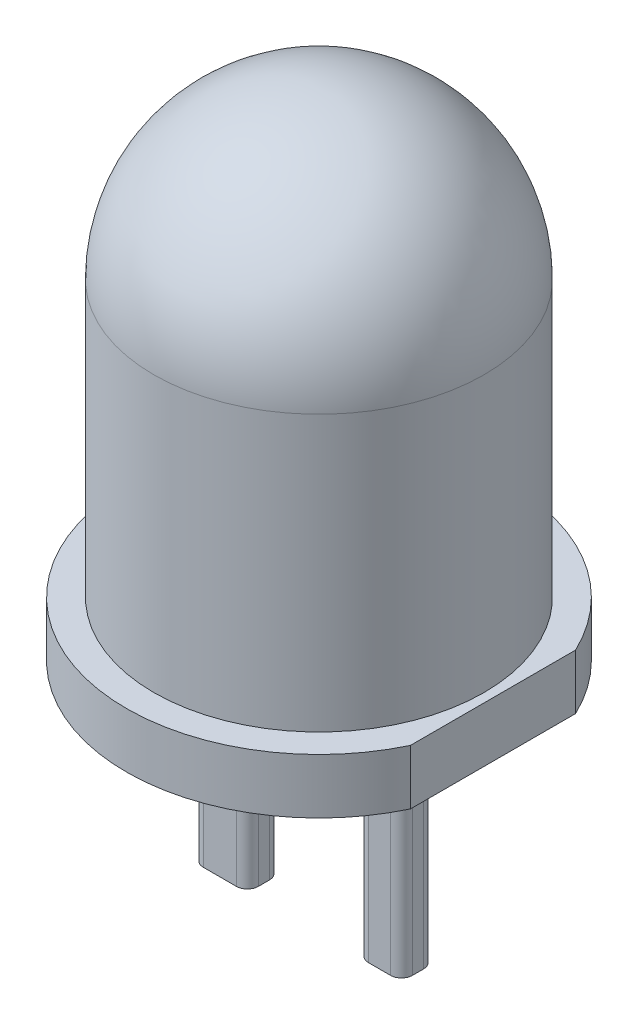
from build123d import *

# Parameters (mm, degrees)
SCHNITT_LINEAR_START            = -1
SCHNITT_LINEAR_AUSTRAGEN1_DEPTH = 1
LINEAR_AUSTRAGEN1_DEPTH         = 2


with BuildPart() as part:
    # Skizze2 → Rotation1 (revolve)
    with BuildSketch(Plane.XY):
        with BuildLine():
            Line((0, 0), (-1.75, 0))
            Line((-1.75, 0), (-1.75, 0.5))
            Line((-1.75, 0.5), (-1.5, 0.5))
            Line((-1.5, 0.5), (-1.5, 3))
            ThreePointArc((-1.5, 3), (-1.060660172, 4.060660172), (0, 4.5))
            Line((0, 4.5), (0, 0))
        make_face()
    revolve(axis=Axis((0, 0, 0), (0, 1, 0)))

    # Skizze3 → Schnitt-Linear austragen1 (cut)
    with BuildSketch(Plane.XZ.offset(SCHNITT_LINEAR_START)):
        with BuildLine():
            Line((1.58113883, -0.75), (1.58113883, 0.75))
            ThreePointArc((1.58113883, 0.75), (1.75, 0), (1.58113883, -0.75))
        make_face()
    extrude(amount=SCHNITT_LINEAR_AUSTRAGEN1_DEPTH, mode=Mode.SUBTRACT)

    # Skizze4 → Linear austragen1 (add)
    with BuildSketch(Plane.XZ):
        with BuildLine():
            Line((0.6, 0.15), (0.8, 0.15))
            ThreePointArc((0.8, 0.15), (0.870710678, 0.120710678), (0.9, 0.05))
            Line((0.9, 0.05), (0.9, -0.05))
            ThreePointArc((0.9, -0.05), (0.870710678, -0.120710678), (0.8, -0.15))
            Line((0.8, -0.15), (0.6, -0.15))
            ThreePointArc((0.6, -0.15), (0.529289322, -0.120710678), (0.5, -0.05))
            Line((0.5, -0.05), (0.5, 0.05))
            ThreePointArc((0.5, 0.05), (0.529289322, 0.120710678), (0.6, 0.15))
        make_face()
        with BuildLine():
            Line((-0.9, 0.15), (-0.6, 0.15))
            ThreePointArc((-0.6, 0.15), (-0.529289322, 0.120710678), (-0.5, 0.05))
            Line((-0.5, 0.05), (-0.5, -0.05))
            ThreePointArc((-0.5, -0.05), (-0.529289322, -0.120710678), (-0.6, -0.15))
            Line((-0.6, -0.15), (-0.9, -0.15))
            ThreePointArc((-0.9, -0.15), (-0.970710678, -0.120710678), (-1, -0.05))
            Line((-1, -0.05), (-1, 0.05))
            ThreePointArc((-1, 0.05), (-0.970710678, 0.120710678), (-0.9, 0.15))
        make_face()
    extrude(amount=LINEAR_AUSTRAGEN1_DEPTH)


solid = part.part
